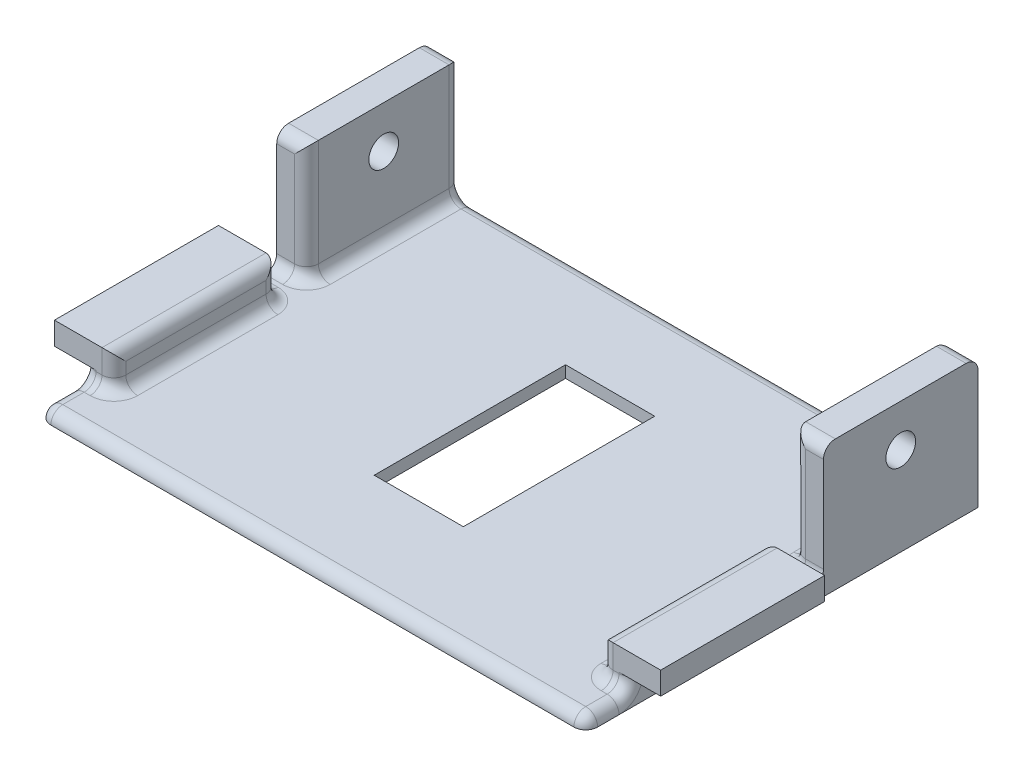
from build123d import *

# Parameters (mm, degrees)
SKETCH2_W               = 116.84
SKETCH2_H               = 33.02
BOSS_EXTRUDE1_DEPTH     = 2.54
SKETCH3_W               = 6.35
SKETCH3_H               = 33.02
BOSS_EXTRUDE2_DEPTH     = 25.4
CUT_EXTRUDE1_DEPTH      = 125.589524439
CUT_EXTRUDE1_DEPTH_BACK = 125.589524439
SKETCH4_R               = 3.175
SKETCH5_W               = 116.84
SKETCH5_H               = 2.54
BOSS_EXTRUDE3_DEPTH     = 50.8
SKETCH6_W               = 6.35
SKETCH6_H               = 35.052
BOSS_EXTRUDE4_DEPTH     = 7.62
SKETCH7_W               = 35.052
SKETCH7_H               = 4.826
BOSS_EXTRUDE5_DEPTH     = 6.35
SKETCH8_W               = 35.052
SKETCH8_H               = 4.826
BOSS_EXTRUDE6_DEPTH     = 6.35
FILLET1_R               = 2.54
FILLET7_R               = 2.54
FILLET8_R               = 2.54
CUT_EXTRUDE2_REACH      = 137.652
SKETCH16_W              = 19.05
SKETCH16_H              = 40.894


with BuildPart() as part:
    # Sketch2 → Boss-Extrude1 (new body)
    with BuildSketch(Plane(origin=(0, 0, 0), x_dir=(1, 0, 0), z_dir=(0, 1, 0))):
        with Locations((58.42, 16.51)):
            Rectangle(SKETCH2_W, SKETCH2_H)
    extrude(amount=BOSS_EXTRUDE1_DEPTH)

    # Sketch3 → Boss-Extrude2 (add)
    with BuildSketch(Plane(origin=(0, 2.54, 0), x_dir=(1, 0, 0), z_dir=(0, 1, 0))):
        with Locations((3.175, 16.51)):
            Rectangle(SKETCH3_W, SKETCH3_H)
        with Locations((113.665, 16.51)):
            Rectangle(SKETCH3_W, SKETCH3_H)
    extrude(amount=BOSS_EXTRUDE2_DEPTH)

    # Sketch4 → Cut-Extrude1 (cut, two sides: drawn at the far end of the back side and taken through both)
    with BuildSketch(Plane.ZY.offset(-CUT_EXTRUDE1_DEPTH_BACK)):
        with Locations((-16.51, 18.93000799)):
            Circle(SKETCH4_R)
    extrude(amount=CUT_EXTRUDE1_DEPTH + CUT_EXTRUDE1_DEPTH_BACK, mode=Mode.SUBTRACT)

    # Sketch5 → Boss-Extrude3 (add)
    with BuildSketch(Plane.XY):
        with Locations((58.42, 1.27)):
            Rectangle(SKETCH5_W, SKETCH5_H)
    extrude(amount=BOSS_EXTRUDE3_DEPTH)

    # Sketch6 → Boss-Extrude4 (add)
    with BuildSketch(Plane(origin=(0, 2.54, 0), x_dir=(1, 0, 0), z_dir=(0, 1, 0))):
        with Locations((3.175, -23.622)):
            Rectangle(SKETCH6_W, SKETCH6_H)
        with Locations((113.665, -23.622)):
            Rectangle(SKETCH6_W, SKETCH6_H)
    extrude(amount=BOSS_EXTRUDE4_DEPTH)

    # Sketch7 → Boss-Extrude5 (add)
    with BuildSketch(Plane.ZY):
        with Locations((23.622, 7.747)):
            Rectangle(SKETCH7_W, SKETCH7_H)
    extrude(amount=BOSS_EXTRUDE5_DEPTH)

    # Sketch8 → Boss-Extrude6 (add)
    with BuildSketch(Plane(origin=(116.84, 0, 0), x_dir=(0, 0, -1), z_dir=(1, 0, 0))):
        with Locations((-23.622, 7.747)):
            Rectangle(SKETCH8_W, SKETCH8_H)
    extrude(amount=BOSS_EXTRUDE6_DEPTH)

    # Fillet1
    fillet1_edges = [part.edges().sort_by_distance(p)[0] for p in [
        (6.35, 2.54, -16.51),
        (6.35, 15.24, 0),
        (6.35, 15.24, -33.02),
        (3.175, 27.94, 0),
        (3.175, 27.94, -33.02),
        (58.42, 2.54, -33.02),
        (110.49, 2.54, -16.51),
        (110.49, 15.24, -33.02),
        (110.49, 15.24, 0),
        (113.665, 27.94, 0),
        (113.665, 27.94, -33.02),
        (3.175, 2.54, 0),
        (113.665, 2.54, 0),
        (3.175, 2.54, 41.148),
        (6.35, 2.54, 23.622),
        (6.35, 6.35, 41.148),
        (3.175, 2.54, 6.096),
        (6.35, 6.35, 6.096),
        (6.35, 10.16, 23.622),
        (113.665, 2.54, 6.096),
        (110.49, 2.54, 23.622),
        (110.49, 6.35, 6.096),
        (113.665, 2.54, 41.148),
        (110.49, 6.35, 41.148),
        (110.49, 10.16, 23.622),
    ]]
    fillet(fillet1_edges, radius=FILLET1_R - 0.0001)  # a hair under: the kernel refuses the full size

    # Fillet7
    fillet7_edges = [part.edges().sort_by_distance(p)[0] for p in [
        (0, 1.27, 50.8),
        (116.84, 1.27, 50.8),
    ]]
    fillet(fillet7_edges, radius=FILLET7_R)

    # Fillet8
    fillet8_edges = [part.edges().sort_by_distance(p)[0] for p in [
        (116.84, 5.20695, 41.148),
        (116.84, 3.283919486, 41.891919486),
        (116.84, 2.54, 45.97395),
        (116.096051224, 2.54, 50.056051224),
        (0, 5.20695, 41.148),
        (0, 3.283919486, 41.891919486),
        (0, 2.54, 45.97395),
        (0.743948776, 2.54, 50.056051224),
        (58.42, 2.54, 50.8),
    ]]
    fillet(fillet8_edges, radius=FILLET8_R - 0.0001)  # a hair under: the kernel refuses the full size

    # Sketch16 → Cut-Extrude2 (cut, up to next)
    with BuildSketch(Plane(origin=(0, 2.54, 0), x_dir=(1, 0, 0), z_dir=(0, 1, 0)), mode=Mode.PRIVATE) as cut_extrude2_sk1:
        with Locations((58.42, -7.62)):
            Rectangle(SKETCH16_W, SKETCH16_H)
    cut_extrude2_tool1 = extrude(cut_extrude2_sk1.sketch, amount=-CUT_EXTRUDE2_REACH, mode=Mode.PRIVATE) & part.part
    add(cut_extrude2_tool1.solids().sort_by_distance((58.42, 2.54, 7.62))[0], mode=Mode.SUBTRACT)


solid = part.part
